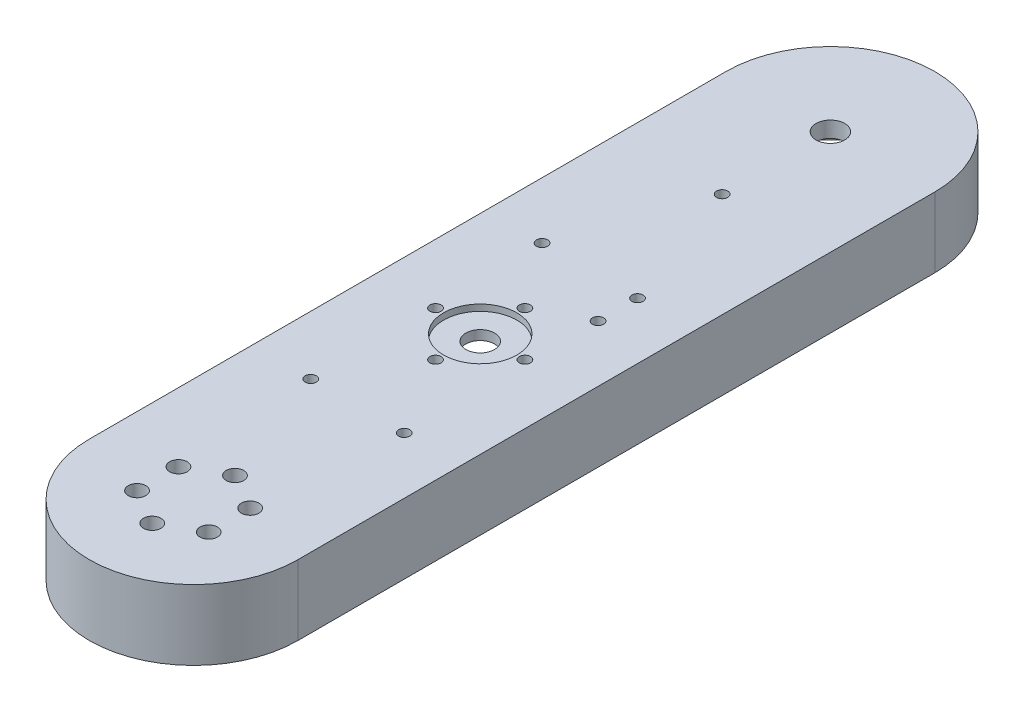
from build123d import *

# Parameters (mm, degrees)
SKETCH1_R            = 2.75
SKETCH1_R_2          = 1.25
SKETCH1_R_3          = 1.75
SKETCH1_R_4          = 4.5
BOSS_EXTRUDE10_DEPTH = 5
BOSS_EXTRUDE9_DEPTH  = 22
SKETCH1_14_R         = 11.5
SKETCH1_14_R_2       = 4.5
CUT_EXTRUDE3_DEPTH   = 2
SKETCH1_16_R         = 1.25
BOSS_EXTRUDE11_DEPTH = 5
BOSS_EXTRUDE12_DEPTH = 22
SKETCH1_17_R         = 2.75
CUT_EXTRUDE4_DEPTH   = 55
CUT_EXTRUDE5_START   = -17
SKETCH3_R            = 1.75
CUT_EXTRUDE5_DEPTH   = 17


with BuildPart() as part:
    # Sketch1 → Boss-Extrude10 (new body)
    with BuildSketch(Plane(origin=(0, 0, 0), x_dir=(1, 0, 0), z_dir=(0, 1, 0))):
        with BuildLine():
            Line((-32.774, 177.619546288), (-32.774, -22.380453712))
            ThreePointArc((-32.774, -22.380453712), (0, -55.154453712), (32.774, -22.380453712))
            Line((32.774, -22.380453712), (32.774, 177.619546288))
            ThreePointArc((32.774, 177.619546288), (0, 210.393546288), (-32.774, 177.619546288))
        make_face()
        with Locations((-11.258330249, -28.880453712)):
            Circle(SKETCH1_R, mode=Mode.SUBTRACT)
        with Locations((-11.258330249, -15.880453712)):
            Circle(SKETCH1_R, mode=Mode.SUBTRACT)
        with Locations((-6.733414, 27.619546288)):
            Circle(SKETCH1_R_2, mode=Mode.SUBTRACT)
        with Locations((-6.733414, 37.119546288)):
            Circle(SKETCH1_R_2, mode=Mode.SUBTRACT)
        with Locations((-14.032659813, 67.637846288)):
            Circle(SKETCH1_R_3, mode=Mode.SUBTRACT)
        with Locations((0, -35.380453712)):
            Circle(SKETCH1_R, mode=Mode.SUBTRACT)
        with Locations((11.258330249, -28.880453712)):
            Circle(SKETCH1_R, mode=Mode.SUBTRACT)
        with Locations((0, -9.380453712)):
            Circle(SKETCH1_R, mode=Mode.SUBTRACT)
        with Locations((11.258330249, -15.880453712)):
            Circle(SKETCH1_R, mode=Mode.SUBTRACT)
        with Locations((0, 53.605186475)):
            Circle(SKETCH1_R_3, mode=Mode.SUBTRACT)
        with Locations((14.032659813, 67.637846288)):
            Circle(SKETCH1_R_3, mode=Mode.SUBTRACT)
        with Locations((0, 81.6705061)):
            Circle(SKETCH1_R_3, mode=Mode.SUBTRACT)
        with Locations((15, 89.637846288)):
            Circle(SKETCH1_R_3, mode=Mode.SUBTRACT)
        with Locations((0, 177.619546288)):
            Circle(SKETCH1_R_4, mode=Mode.SUBTRACT)
        with Locations((0, 67.637846288)):
            Circle(SKETCH1_R_4, mode=Mode.SUBTRACT)
    extrude(amount=-BOSS_EXTRUDE10_DEPTH)

    # Sketch2 → Boss-Extrude9 (add)
    with BuildSketch(Plane.XZ):
        with BuildLine():
            ThreePointArc((32.774000001, 22.380453712), (0, 55.154453713), (-32.774000001, 22.380453712))
            Line((-32.774000001, 22.380453712), (-32.774000001, -177.619773144))
            ThreePointArc((-32.774000001, -177.619773144), (0, -210.393773145), (32.774000001, -177.619773144))
            Line((32.774000001, -177.619773144), (32.774000001, 22.380453712))
        make_face()
        with BuildLine():
            Line((28, -97.619319431), (28, -177.619773144))
            ThreePointArc((28, -177.619773144), (0, -205.619773144), (-28, -177.619773144))
            Line((-28, -177.619773144), (-28, -97.62))
            Line((-28, -97.62), (-28, -4.769011255))
            Line((-28, -4.769011255), (-28, 22.380453712))
            ThreePointArc((-28, 22.380453712), (0, 50.380453712), (28, 22.380453712))
            Line((28, 22.380453712), (28, -4.769011255))
            Line((28, -4.769011255), (28, -97.619319431))
        make_face(mode=Mode.SUBTRACT)
    extrude(amount=BOSS_EXTRUDE9_DEPTH)

    # Sketch1<14> → Cut-Extrude3 (cut)
    with BuildSketch(Plane(origin=(0, 0, 0), x_dir=(1, 0, 0), z_dir=(0, 1, 0))):
        with Locations((0, 67.637846288)):
            Circle(SKETCH1_14_R)
        with Locations((0, 67.637846288)):
            Circle(SKETCH1_14_R_2, mode=Mode.SUBTRACT)
    extrude(amount=-CUT_EXTRUDE3_DEPTH, mode=Mode.SUBTRACT)

    # Sketch1<16> → Boss-Extrude11 (add)
    with BuildSketch(Plane(origin=(0, 0, 0), x_dir=(1, 0, 0), z_dir=(0, 1, 0))):
        with Locations((-6.733414, 37.119546288)):
            Circle(SKETCH1_16_R)
        with Locations((-6.733414, 27.619546288)):
            Circle(SKETCH1_16_R)
    extrude(amount=-BOSS_EXTRUDE11_DEPTH)

    # Sketch2<13> → Boss-Extrude12 (add)
    with BuildSketch(Plane.XZ):
        with BuildLine():
            Line((-28, -4.769011255), (28, -4.769011255))
            Line((28, -4.769011255), (28, 22.380453712))
            ThreePointArc((28, 22.380453712), (0, 50.380453712), (-28, 22.380453712))
            Line((-28, 22.380453712), (-28, -4.769011255))
        make_face()
    extrude(amount=BOSS_EXTRUDE12_DEPTH)

    # Sketch1<17> → Cut-Extrude4 (cut)
    with BuildSketch(Plane(origin=(0, 0, 0), x_dir=(1, 0, 0), z_dir=(0, 1, 0))):
        with Locations((0, -9.380453712)):
            Circle(SKETCH1_17_R)
        with Locations((11.258330249, -15.880453712)):
            Circle(SKETCH1_17_R)
        with Locations((11.258330249, -28.880453712)):
            Circle(SKETCH1_17_R)
        with Locations((0, -35.380453712)):
            Circle(SKETCH1_17_R)
        with Locations((-11.258330249, -28.880453712)):
            Circle(SKETCH1_17_R)
        with Locations((-11.258330249, -15.880453712)):
            Circle(SKETCH1_17_R)
    extrude(amount=-CUT_EXTRUDE4_DEPTH, mode=Mode.SUBTRACT)

    # Sketch3 → Cut-Extrude5 (cut)
    with BuildSketch(Plane.XZ.offset(5).offset(CUT_EXTRUDE5_START)):
        with Locations((15, -89.637846288)):
            Circle(SKETCH3_R)
        with Locations((15, -28.769011255)):
            Circle(SKETCH3_R)
        with Locations((-14.353546197, -28.769011255)):
            Circle(SKETCH3_R)
        with Locations((-15, -102.056321071)):
            Circle(SKETCH3_R)
        with Locations((15, -102.056321071)):
            Circle(SKETCH3_R)
        with Locations((0, -143.619773144)):
            Circle(SKETCH3_R)
    extrude(amount=CUT_EXTRUDE5_DEPTH, mode=Mode.SUBTRACT)


solid = part.part
